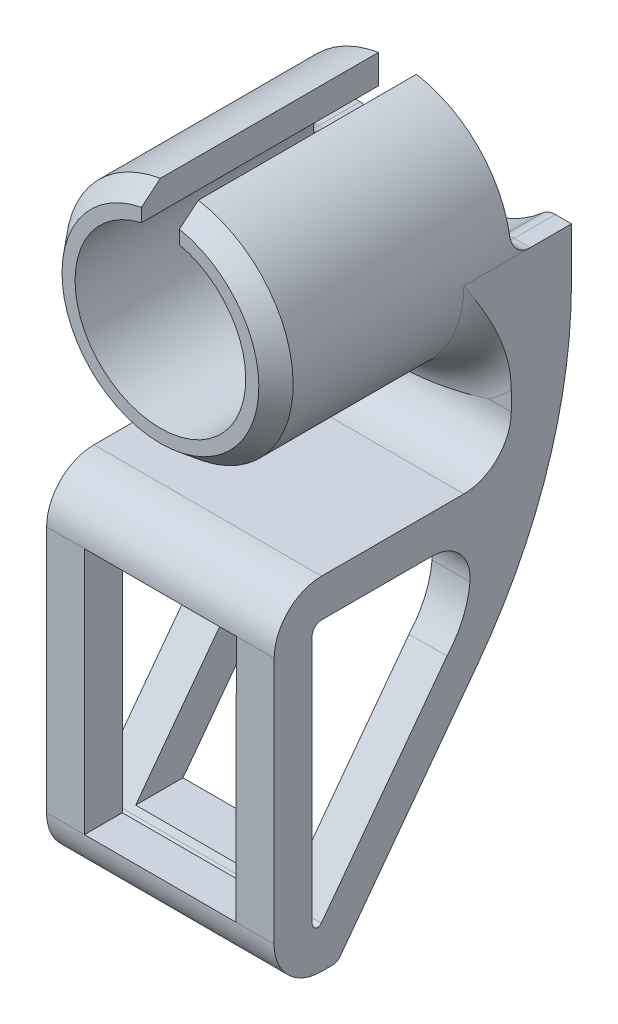
from build123d import *

# Parameters (mm, degrees)
SKETCH1_R           = 12
BOSS_EXTRUDE1_DEPTH = 25
CUT_EXTRUDE1_DEPTH  = 25
BOSS_EXTRUDE2_DEPTH = 6.35
FILLET1_R           = 7.62
CHAMFER1_SIZE       = 2
CHAMFER1_SIZE2      = 1.6195680663900194
BOSS_EXTRUDE3_DEPTH = 3
BOSS_EXTRUDE4_DEPTH = 24
FILLET3_R           = 50
FILLET7_R           = 5
FILLET8_R           = 5
FILLET9_R           = 5
CUT_EXTRUDE2_DEPTH  = 24
FILLET10_R          = 1
FILLET12_R          = 2
FILLET13_R          = 2
CUT_EXTRUDE3_REACH  = 66.534
SKETCH9_W           = 16.00000000000001
SKETCH9_H           = 26.111776117406702
FILLET14_R          = 0.5
FILLET15_R          = 4


with BuildPart() as part:
    # Sketch1 → Boss-Extrude1 (new body)
    with BuildSketch(Plane.XY):
        Circle(SKETCH1_R)
    extrude(amount=BOSS_EXTRUDE1_DEPTH)

    # Sketch2 → Cut-Extrude1 (cut)
    with BuildSketch(Plane.XY.offset(25)):
        with BuildLine():
            Line((-2, 12), (2, 12))
            Line((2, 12), (2, 8.77496438739212))
            ThreePointArc((2, 8.77496438739212), (-1.65e-15, -8.999999999999998), (-2, 8.77496438739212))
            Line((-2, 8.77496438739212), (-2, 12))
        make_face()
    extrude(amount=-CUT_EXTRUDE1_DEPTH, mode=Mode.SUBTRACT)

    # Sketch3 → Boss-Extrude2 (add)
    with BuildSketch(Plane(origin=(0, 0, 0), x_dir=(-1, 0, 0), z_dir=(0, 0, -1))):
        with BuildLine():
            Line((-9.50278743316929, 0), (-12.000000000000002, 0))
            Line((-12.000000000000002, 0), (-12.000000000000004, -19))
            Line((-12.000000000000004, -19), (12.000000000000004, -19))
            Line((12.000000000000004, -19), (12.000000000000002, 0))
            Line((12.000000000000002, 0), (9.50278743316929, 0))
            ThreePointArc((9.50278743316929, 0), (8.2e-16, -3.9369999999999994), (-9.50278743316929, 0))
        make_face()
    extrude(amount=BOSS_EXTRUDE2_DEPTH)

    # Fillet1
    # the kernel refuses this fillet: 7.62 mm, written as the material it adds along each edge
    with BuildSketch(Plane(origin=(-8.3e-16, 4.2e-16, 0), x_dir=(0.0031415874858799547, 0.9999950652018581, 0), z_dir=(-0.9999950652018581, 0.0031415874858799547, 0))) as fillet1_piece_1_section:
        with BuildLine():
            CenterArc((8.999999999999998 - FILLET1_R, -FILLET1_R), FILLET1_R, 0, 89.99999999999999)
            Line((8.999999999999998 - FILLET1_R, 2.66e-15), (8.999999999999998, 0))
            Line((8.999999999999998, 0), (8.999999999999996, -FILLET1_R))
        make_face()
    fillet1_piece_1 = revolve(axis=Axis((-8.3e-16, 4.2e-16, 0), (0, 0, -1)), revolution_arc=359.64, mode=Mode.PRIVATE)
    fillet1_piece_1 = fillet1_piece_1 - Plane(origin=(0, 9.500000000000028, 1.752978238820399), x_dir=(-0.7072104958822112, -0.7070030512763273, 0), z_dir=(0, 0, 1)) * Cylinder(13.437000000000028, 36, mode=Mode.PRIVATE)
    add(fillet1_piece_1)

    # Chamfer1
    chamfer1_edges = [part.edges().sort_by_distance(p)[0] for p in [
        (-1.0525e-13, -12, 25),
    ]]
    chamfer1_side = [part.faces().sort_by_distance(p)[0] for p in [
        (-2.2e-15, -12, 12.5),
    ]]
    chamfer(chamfer1_edges, length=CHAMFER1_SIZE, length2=CHAMFER1_SIZE2, reference=chamfer1_side[0])

    # Sketch6 → Boss-Extrude3 (add)
    with BuildSketch(Plane.XZ.offset(19)):
        Polygon((-12.000000000000007, 25), (-12.000000000000005, -6.35), (12.000000000000005, -6.35), (12.000000000000004, 25.00000000000001), align=None)
    extrude(amount=BOSS_EXTRUDE3_DEPTH)

    # Sketch7 → Boss-Extrude4 (add)
    with BuildSketch(Plane(origin=(12.000000000000002, 1.1e-15, 0), x_dir=(0, 0, -1), z_dir=(1, 1.9e-16, 0))):
        Polygon((-25.00000000000001, -22.000000000000004), (6.35, -22.000000000000004), (-18.348646063087493, -55.11177405445072), (-25.013162071560505, -55.11177405445072), align=None)
    extrude(amount=-BOSS_EXTRUDE4_DEPTH)

    # Fillet3
    fillet3_edges = [part.edges().sort_by_distance(p)[0] for p in [
        (0, -22, -6.35),
    ]]
    fillet(fillet3_edges, radius=FILLET3_R)

    # Fillet7
    # the kernel refuses this fillet: 5 mm, written as the material it adds along each edge
    with BuildSketch(Plane(origin=(0, 0, 0), x_dir=(-1, 6e-17, 0), z_dir=(6e-17, 1, 0))) as fillet7_piece_1_section:
        with BuildLine():
            CenterArc((12.000000000000002 + FILLET7_R, FILLET7_R), FILLET7_R, 180, 90)
            Line((12, FILLET7_R), (12.000000000000002, 0))
            Line((12.000000000000002, 0), (12.000000000000002 + FILLET7_R, 0))
        make_face()
    fillet7_piece_1 = revolve(axis=Axis((0, 0, 0), (0, 0, 1)), revolution_arc=179.99999999999997, mode=Mode.PRIVATE)
    fillet7_piece_1 = split(fillet7_piece_1, bisect_by=Plane(origin=(12.000000000000004, -12.055106327045037, 2.4999999999999996), z_dir=(-1, -9e-17, 0)), keep=Keep.TOP, mode=Mode.PRIVATE)
    fillet7_piece_1 = split(fillet7_piece_1, bisect_by=Plane(origin=(-12.000000000000004, -12.055106327045038, 2.4999999999999996), z_dir=(1, -9e-17, 0)), keep=Keep.TOP, mode=Mode.PRIVATE)
    add(fillet7_piece_1)
    with BuildSketch(Plane(origin=(12.000000000000004, -19, 0), x_dir=(0, 1, 0), z_dir=(-1, 0, 0))) as fillet7_piece_2:
        with BuildLine():
            CenterArc((FILLET7_R, -FILLET7_R), FILLET7_R, 90, 90)
            Line((0, -FILLET7_R), (0, 0))
            Line((0, 0), (FILLET7_R, 0))
        make_face()
    extrude(amount=24.000000000000007)

    # Fillet8
    fillet8_edges = [part.edges().sort_by_distance(p)[0] for p in [
        (1.243e-14, -55.11177405445072, 25.013162071560505),
    ]]
    fillet(fillet8_edges, radius=FILLET8_R)

    # Fillet9
    fillet9_edges = [part.edges().sort_by_distance(p)[0] for p in [
        (-1.78e-15, -19, 25.000000000000007),
    ]]
    fillet(fillet9_edges, radius=FILLET9_R)

    # Sketch8 → Cut-Extrude2 (cut)
    with BuildSketch(Plane(origin=(12.000000000000002, 1.1e-15, 0), x_dir=(0, 0, -1), z_dir=(1, 1.9e-16, 0))):
        with BuildLine():
            Line((-4.999999999999998, -23), (-20.000794613515104, -23.000000000000004))
            ThreePointArc((-20.000794613515104, -23.000000000000004), (-20.70776084176148, -23.292752693805703), (-21.000794534510295, -23.999602495761817))
            Line((-21.000794534510295, -23.999602495761817), (-21.011174076183625, -50.11137655021254))
            ThreePointArc((-21.011174076183625, -50.11137655021254), (-20.819933843558175, -50.699913295165096), (-20.318980441541633, -51.06322310199948))
            Line((-20.318980441541633, -51.06322310199948), (-6.777868461008763, -32.90958669617576))
            ThreePointArc((-6.777868461008763, -32.90958669617576), (-4.469648137926145, -28.20942596380706), (-4.999999999999998, -23))
        make_face()
    extrude(amount=-CUT_EXTRUDE2_DEPTH, mode=Mode.SUBTRACT)

    # Fillet10
    fillet10_edges = [part.edges().sort_by_distance(p)[0] for p in [
        (1.243e-14, -55.11177405445072, 18.348646063087493),
    ]]
    fillet(fillet10_edges, radius=FILLET10_R)

    # Fillet12
    fillet12_edges = [part.edges().sort_by_distance(p)[0] for p in [
        (-9.502787433169292, -8.9e-16, -3.175),
        (9.502787433169292, -8.9e-16, -3.175),
    ]]
    fillet(fillet12_edges, radius=FILLET12_R)

    # Fillet13
    # the kernel refuses this fillet: 2 mm, written as the material it adds along each edge
    with BuildSketch(Plane(origin=(10.298105116962052, 0, 0), x_dir=(0, 0, -1), z_dir=(1, 0, 0))) as fillet13_piece_1_section:
        with BuildLine():
            CenterArc((FILLET13_R, FILLET13_R), FILLET13_R, 180, 90)
            Line((-2.2e-16, FILLET13_R), (0, 0))
            Line((0, 0), (FILLET13_R, 0))
        make_face()
    fillet13_piece_1 = extrude(amount=6.701894883037948, mode=Mode.PRIVATE)
    fillet13_piece_1 = fillet13_piece_1 & Plane(origin=(0, 0, -0.44903446636731825), x_dir=(1, 0, 0), z_dir=(0, 0, -1)) * Cylinder(12, 22, mode=Mode.PRIVATE)
    add(fillet13_piece_1)
    with BuildSketch(Plane(origin=(-10.298105116962049, -2, 0), x_dir=(-0.07369380939887726, -0.9972809145152042, 0), z_dir=(-0.9972809145152042, 0.07369380939887726, 0))) as fillet13_piece_2_section:
        with BuildLine():
            CenterArc((2.0000000000000004 + FILLET13_R, -FILLET13_R), FILLET13_R, 89.99999999999997, 90)
            Line((2.0000000000000004 + FILLET13_R, 2.2e-16), (2.0000000000000004, 0))
            Line((2.0000000000000004, 0), (2, -FILLET13_R))
        make_face()
    fillet13_piece_2 = revolve(axis=Axis((-10.298105116962049, -2, 0), (0, 0, 1)), revolution_arc=184.22617539365706, mode=Mode.PRIVATE)
    fillet13_piece_2 = fillet13_piece_2 - Plane(origin=(-8.3e-16, 4.2e-16, -0.6407272575669332), x_dir=(0.22222222222222238, 0.9749960430435691, 0), z_dir=(0, 0, 1)) * Cylinder(8.999999999999998, 17, mode=Mode.PRIVATE)
    add(fillet13_piece_2)
    with BuildSketch(Plane(origin=(10.298105116962052, -2, 0), x_dir=(0, 1, 0), z_dir=(1, 0, 0))) as fillet13_piece_3_section:
        with BuildLine():
            CenterArc((2 + FILLET13_R, -FILLET13_R), FILLET13_R, 90, 90)
            Line((2 + FILLET13_R, 2.2e-16), (2, 0))
            Line((2, 0), (2, -FILLET13_R))
        make_face()
    fillet13_piece_3 = revolve(axis=Axis((10.298105116962052, -2, 0), (0, 0, 1)), revolution_arc=184.22617539365754, mode=Mode.PRIVATE)
    fillet13_piece_3 = fillet13_piece_3 - Plane(origin=(-8.3e-16, 4.2e-16, -0.8153326958488982), x_dir=(0.22222222222222238, 0.9749960430435691, 0), z_dir=(0, 0, 1)) * Cylinder(8.999999999999998, 16, mode=Mode.PRIVATE)
    add(fillet13_piece_3)
    with BuildSketch(Plane(origin=(-17, 0, 0), x_dir=(0, 0, -1), z_dir=(1, 0, 0))) as fillet13_piece_4_section:
        with BuildLine():
            CenterArc((FILLET13_R, FILLET13_R), FILLET13_R, 180, 90)
            Line((-2.2e-16, FILLET13_R), (0, 0))
            Line((0, 0), (FILLET13_R, 0))
        make_face()
    fillet13_piece_4 = extrude(amount=6.7018948830379514, mode=Mode.PRIVATE)
    fillet13_piece_4 = fillet13_piece_4 & Plane(origin=(0, 0, -0.4490342356486683), x_dir=(1, 0, 0), z_dir=(0, 0, -1)) * Cylinder(12, 22, mode=Mode.PRIVATE)
    add(fillet13_piece_4)

    # Cut-Extrude3: up to this plane
    cut_extrude3_end = Plane(origin=(-57.60742830022284, -22.000000000000018, -6.35), z_dir=(0, -0.5979035190056836, -0.8015680769345921))
    # Sketch9 → Cut-Extrude3 (cut, up to the surface)
    with BuildSketch(Plane(origin=(0, 0.00993412895799998, 24.991250957210262), x_dir=(1, 0, 0), z_dir=(0, 0.0003975042381898005, 0.9999999209951873)), mode=Mode.PRIVATE) as cut_extrude3_sk1:
        with Locations((0, -37.06383656321388)):
            Rectangle(SKETCH9_W, SKETCH9_H)
    cut_extrude3_tool1 = split(extrude(cut_extrude3_sk1.sketch, amount=-CUT_EXTRUDE3_REACH, mode=Mode.PRIVATE), bisect_by=cut_extrude3_end, keep=Keep.BOTH, mode=Mode.PRIVATE)
    add(cut_extrude3_tool1.solids().sort_by_distance((0, -37.0539, 25.005984))[0], mode=Mode.SUBTRACT)

    # Fillet14
    fillet14_edges = [part.edges().sort_by_distance(p)[0] for p in [
        (1.243e-14, -51.06322310199948, 20.318980441541633),
    ]]
    fillet(fillet14_edges, radius=FILLET14_R)

    # Fillet15
    # the kernel refuses this fillet: 4 mm, written as the material it adds along each edge
    with BuildSketch(Plane(origin=(12.000000000000007, -23, 4.999999999999999), x_dir=(0, -0.9891358109581738, -0.14700458319425255), z_dir=(-1, -1.9e-16, 0))) as fillet15_piece_1_section:
        with BuildLine():
            CenterArc((3.4655066348003034, 3.8920098406036834), FILLET15_R, 188.453377446245, 94.89048853854467)
            Line((-0.49103660903239127, 3.30399150782667), (0, 0))
            ThreePointArc((0, 0), (2.194342799690448, -0.2566863390527839), (4.388685599380896, -1e-17))
        make_face()
    fillet15_piece_1 = extrude(amount=24, mode=Mode.PRIVATE)
    fillet15_piece_1 = split(fillet15_piece_1, bisect_by=Plane(origin=(9.999999999999988, -24.006080855539047, 4.703209142937297), z_dir=(0, -0.9999999209951872, 0.0003975042381898005)), keep=Keep.TOP, mode=Mode.PRIVATE)
    fillet15_piece_1 = split(fillet15_piece_1, bisect_by=Plane(origin=(8.000000000000005, -24.97983402678631, 4.7035962139803935), z_dir=(1, 0, 0)), keep=Keep.TOP, mode=Mode.PRIVATE)
    add(fillet15_piece_1)
    with BuildSketch(Plane(origin=(12.000000000000007, -23, 4.999999999999999), x_dir=(0, -0.9891358109581738, -0.14700458319425255), z_dir=(-1, -1.9e-16, 0))) as fillet15_piece_2_section:
        with BuildLine():
            CenterArc((3.4655066348003034, 3.8920098406036834), FILLET15_R, 188.453377446245, 94.89048853854467)
            Line((-0.49103660903239127, 3.30399150782667), (0, 0))
            ThreePointArc((0, 0), (2.194342799690448, -0.2566863390527839), (4.388685599380896, -1e-17))
        make_face()
    fillet15_piece_2 = extrude(amount=24, mode=Mode.PRIVATE)
    fillet15_piece_2 = split(fillet15_piece_2, bisect_by=Plane(origin=(10.000000000000005, -24.005623928158137, 5.8526996411826), z_dir=(0, 0.9999999209951872, -0.0003975042381898005)), keep=Keep.TOP, mode=Mode.PRIVATE)
    fillet15_piece_2 = split(fillet15_piece_2, bisect_by=Plane(origin=(8.000000000000005, -23.360559138010366, 5.852443225174344), z_dir=(1, 0, 0)), keep=Keep.TOP, mode=Mode.PRIVATE)
    add(fillet15_piece_2)
    with BuildSketch(Plane(origin=(12.000000000000007, -23, 4.999999999999999), x_dir=(0, -0.9891358109581738, -0.14700458319425255), z_dir=(-1, -1.9e-16, 0))) as fillet15_piece_3_section:
        with BuildLine():
            CenterArc((3.4655066348003034, 3.8920098406036834), FILLET15_R, 188.453377446245, 94.89048853854467)
            Line((-0.49103660903239127, 3.30399150782667), (0, 0))
            ThreePointArc((0, 0), (2.194342799690448, -0.2566863390527839), (4.388685599380896, -1e-17))
        make_face()
    fillet15_piece_3 = extrude(amount=24, mode=Mode.PRIVATE)
    fillet15_piece_3 = split(fillet15_piece_3, bisect_by=Plane(origin=(-8.000000000000005, -23.360559138010377, 5.852443225174344), z_dir=(1, 0, 0)), keep=Keep.TOP, mode=Mode.PRIVATE)
    fillet15_piece_3 = split(fillet15_piece_3, bisect_by=Plane(origin=(-2.309e-14, -24.005623928158137, 5.8526996411826), z_dir=(0, 0.9999999209951872, -0.0003975042381898005)), keep=Keep.TOP, mode=Mode.PRIVATE)
    fillet15_piece_3 = split(fillet15_piece_3, bisect_by=Plane(origin=(8.000000000000005, -23.36055913801037, 5.852443225174344), z_dir=(-1, 0, 0)), keep=Keep.TOP, mode=Mode.PRIVATE)
    add(fillet15_piece_3)
    with BuildSketch(Plane(origin=(12.000000000000007, -23, 4.999999999999999), x_dir=(0, -0.9891358109581738, -0.14700458319425255), z_dir=(-1, -1.9e-16, 0))) as fillet15_piece_4_section:
        with BuildLine():
            CenterArc((3.4655066348003034, 3.8920098406036834), FILLET15_R, 188.453377446245, 94.89048853854467)
            Line((-0.49103660903239127, 3.30399150782667), (0, 0))
            ThreePointArc((0, 0), (2.194342799690448, -0.2566863390527839), (4.388685599380896, -1e-17))
        make_face()
    fillet15_piece_4 = extrude(amount=24, mode=Mode.PRIVATE)
    fillet15_piece_4 = split(fillet15_piece_4, bisect_by=Plane(origin=(-8.000000000000005, -24.979834026786307, 4.7035962139803935), z_dir=(-1, 0, 0)), keep=Keep.TOP, mode=Mode.PRIVATE)
    fillet15_piece_4 = split(fillet15_piece_4, bisect_by=Plane(origin=(-10.000000000000005, -24.006080855539047, 4.703209142937297), z_dir=(0, -0.9999999209951872, 0.0003975042381898005)), keep=Keep.TOP, mode=Mode.PRIVATE)
    add(fillet15_piece_4)
    with BuildSketch(Plane(origin=(12.000000000000007, -23, 4.999999999999999), x_dir=(0, -0.9891358109581738, -0.14700458319425255), z_dir=(-1, -1.9e-16, 0))) as fillet15_piece_5_section:
        with BuildLine():
            CenterArc((3.4655066348003034, 3.8920098406036834), FILLET15_R, 188.453377446245, 94.89048853854467)
            Line((-0.49103660903239127, 3.30399150782667), (0, 0))
            ThreePointArc((0, 0), (2.194342799690448, -0.2566863390527839), (4.388685599380896, -1e-17))
        make_face()
    fillet15_piece_5 = extrude(amount=24, mode=Mode.PRIVATE)
    fillet15_piece_5 = split(fillet15_piece_5, bisect_by=Plane(origin=(-8.000000000000005, -23.36055913801038, 5.852443225174344), z_dir=(-1, 0, 0)), keep=Keep.TOP, mode=Mode.PRIVATE)
    fillet15_piece_5 = split(fillet15_piece_5, bisect_by=Plane(origin=(-10.000000000000002, -24.005623928158137, 5.8526996411826), z_dir=(0, 0.9999999209951872, -0.0003975042381898005)), keep=Keep.TOP, mode=Mode.PRIVATE)
    add(fillet15_piece_5)


solid = part.part
